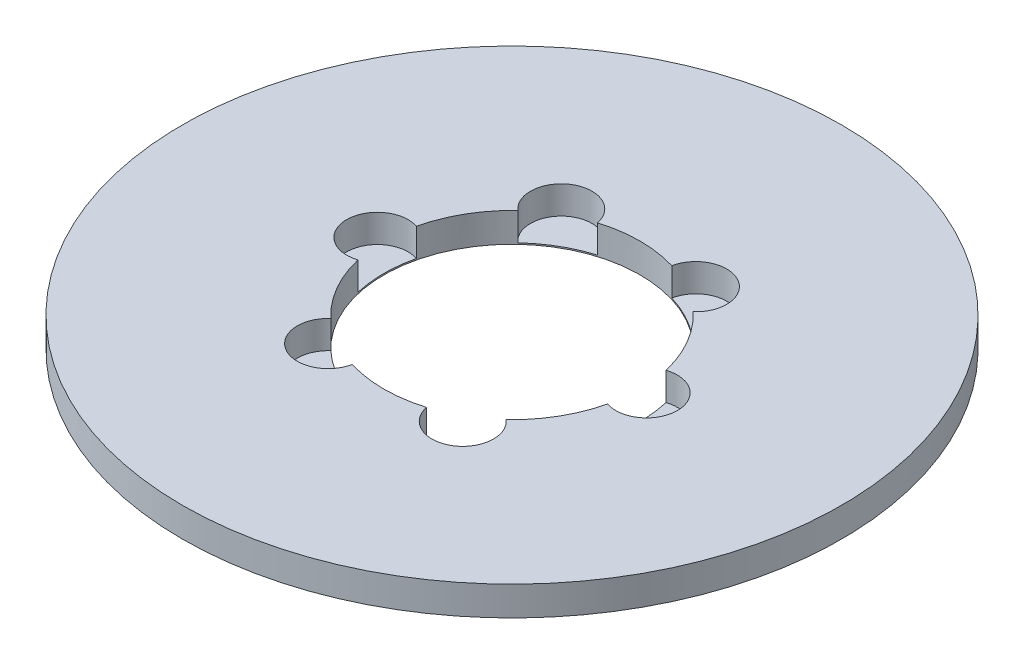
from build123d import *

# Parameters (mm, degrees)
SKETCH1_R           = 45
BOSS_EXTRUDE1_DEPTH = 4
SKETCH2_R           = 17.5
CUT_EXTRUDE1_DEPTH  = 64.765194268
SKETCH3_R           = 4.201956018
CUT_EXTRUDE2_DEPTH  = 3.818254214
CIRPATTERN1_COUNT   = 6


with BuildPart() as part:
    # Sketch1 → Boss-Extrude1 (new body)
    with BuildSketch(Plane(origin=(0, 0, 0), x_dir=(1, 0, 0), z_dir=(0, 1, 0))):
        Circle(SKETCH1_R)
    extrude(amount=BOSS_EXTRUDE1_DEPTH)

    # Sketch2 → Cut-Extrude1 (cut, through all)
    with BuildSketch(Plane(origin=(0, 0, 0), x_dir=(1, 0, 0), z_dir=(0, 1, 0))):
        Circle(SKETCH2_R)
    extrude(amount=CUT_EXTRUDE1_DEPTH, mode=Mode.SUBTRACT)

    # Sketch3 → Cut-Extrude2 (cut)
    with BuildSketch(Plane(origin=(0, 4, 0), x_dir=(1, 0, 0), z_dir=(0, 1, 0))):
        with Locations((-18.381067401, 0)):
            Circle(SKETCH3_R)
    cut_extrude2 = extrude(amount=-CUT_EXTRUDE2_DEPTH, mode=Mode.SUBTRACT)

    # CirPattern1: Cut-Extrude2 ×6 about axis
    cirpattern1_axis = Axis((0, 0, 0), (0, 1, 0))
    for i in range(1, CIRPATTERN1_COUNT):
        add(cut_extrude2.rotate(cirpattern1_axis, i * 360 / CIRPATTERN1_COUNT), mode=Mode.SUBTRACT)


solid = part.part
